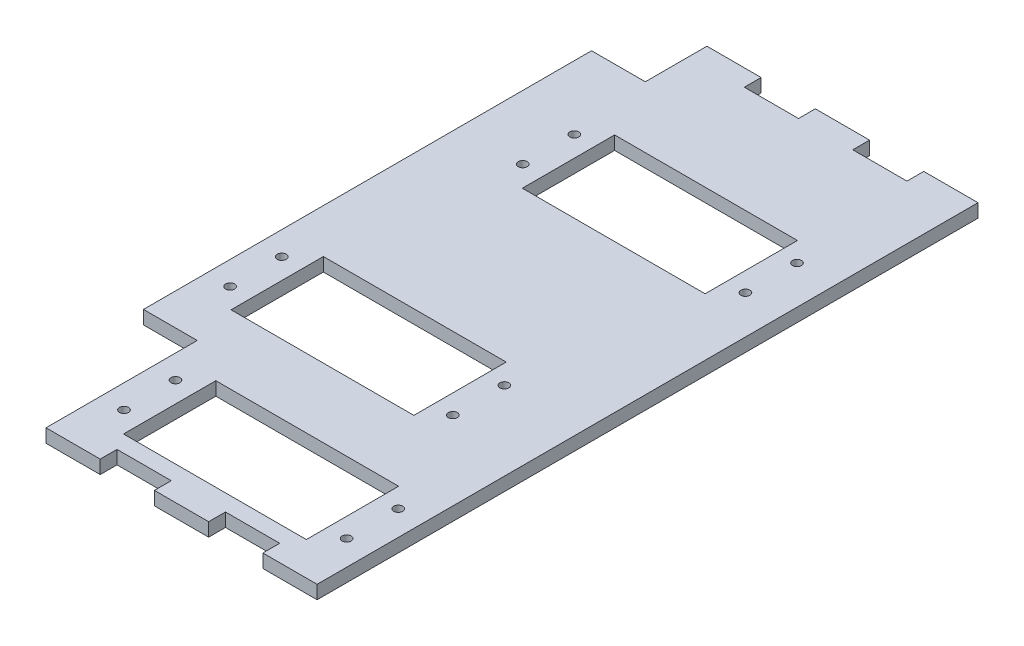
from build123d import *

# Parameters (mm, degrees)
SKETCH1_W           = 40.8
SKETCH1_H           = 20.6
BOSS_EXTRUDE4_DEPTH = 3
SKETCH2_R           = 1
CUT_EXTRUDE1_DEPTH  = 86.047780688


with BuildPart() as part:
    # Sketch1 → Boss-Extrude4 (new body)
    with BuildSketch(Plane(origin=(0, 0, 0), x_dir=(1, 0, 0), z_dir=(0, 1, 0))):
        Polygon((30.25, -73.75), (30.25, -70), (30.25, 70), (30.25, 73.75), (18.15, 73.75), (18.15, 70), (6.05, 70), (6.05, 73.75), (-6.05, 73.75), (-6.05, 70), (-18.15, 70), (-18.15, 73.75), (-30.25, 73.75), (-30.25, 70), (-30.25, 60), (-42.25, 60), (-42.25, -40), (-30.25, -40), (-30.25, -70), (-30.25, -73.75), (-18.15, -73.75), (-18.15, -70), (-6.05, -70), (-6.05, -73.75), (6.05, -73.75), (6.05, -70), (18.15, -70), (18.15, -73.75), align=None)
        with Locations((-12, -20)):
            Rectangle(SKETCH1_W, SKETCH1_H, mode=Mode.SUBTRACT)
        with Locations((0, -56)):
            Rectangle(SKETCH1_W, SKETCH1_H, mode=Mode.SUBTRACT)
        with Locations((-3, 36)):
            Rectangle(SKETCH1_W, SKETCH1_H, mode=Mode.SUBTRACT)
    extrude(amount=BOSS_EXTRUDE4_DEPTH)

    # Sketch2 → Cut-Extrude1 (cut, through all)
    with BuildSketch(Plane(origin=(0, 3, 0), x_dir=(1, 0, 0), z_dir=(0, 1, 0))):
        with Locations((-25, -50.1)):
            Circle(SKETCH2_R)
        with Locations((-25, -61.6)):
            Circle(SKETCH2_R)
        with Locations((-37, -25.9)):
            Circle(SKETCH2_R)
        with Locations((-28, 30.4)):
            Circle(SKETCH2_R)
        with Locations((-28, 41.9)):
            Circle(SKETCH2_R)
        with Locations((21.7, 41.9)):
            Circle(SKETCH2_R)
        with Locations((21.7, 30.4)):
            Circle(SKETCH2_R)
        with Locations((12.7, -14.4)):
            Circle(SKETCH2_R)
        with Locations((12.7, -25.9)):
            Circle(SKETCH2_R)
        with Locations((24.7, -50.1)):
            Circle(SKETCH2_R)
        with Locations((24.7, -61.6)):
            Circle(SKETCH2_R)
        with Locations((-37, -14.4)):
            Circle(SKETCH2_R)
    extrude(amount=-CUT_EXTRUDE1_DEPTH, mode=Mode.SUBTRACT)


solid = part.part
